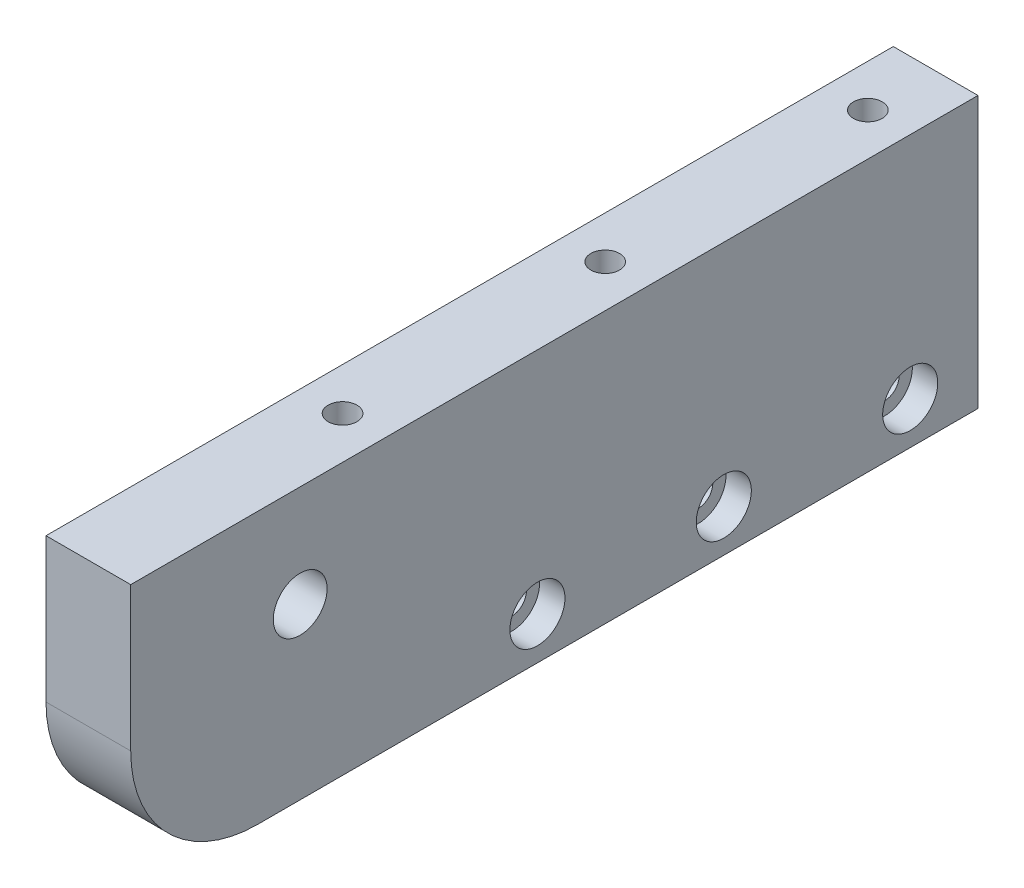
from build123d import *

# Parameters (mm, degrees)
SKETCH1_W                      = 100
SKETCH1_H                      = 32
SKETCH1_R                      = 3.175
BOSS_EXTRUDE1_DEPTH            = 10
FILLET1_R                      = 15
CBORE_FOR_M3_SHCS_D            = 3.4
CBORE_FOR_M3_SHCS_DEPTH        = 23
CBORE_FOR_M3_SHCS_CBORE_D      = 6.5
CBORE_FOR_M3_SHCS_CBORE_DEPTH  = 3
CBORE_FOR_M3_SHCS_TIP          = 1.021463052
CBORE_FOR_M3_SHCS1_D           = 3.4
CBORE_FOR_M3_SHCS1_DEPTH       = 23
CBORE_FOR_M3_SHCS1_CBORE_D     = 6.5
CBORE_FOR_M3_SHCS1_CBORE_DEPTH = 3
CBORE_FOR_M3_SHCS1_TIP         = 1.021463052


with BuildPart() as part:
    # Sketch1 → Boss-Extrude1 (new body)
    with BuildSketch(Plane(origin=(0, 0, 0), x_dir=(0, 0, -1), z_dir=(1, 0, 0))):
        Rectangle(SKETCH1_W, SKETCH1_H)
        with Locations((-30, 4)):
            Circle(SKETCH1_R, mode=Mode.SUBTRACT)
    extrude(amount=BOSS_EXTRUDE1_DEPTH)

    # Fillet1
    fillet1_edges = [part.edges().sort_by_distance(p)[0] for p in [
        (5, -16, 50),
    ]]
    fillet(fillet1_edges, radius=FILLET1_R)

    # CBORE for M3 SHCS
    with Locations(Plane(origin=(-726.293536786, 26, -1323.282701689), x_dir=(1, 0, 0), z_dir=(0, 1, 0))):
        with Locations((731.293536786, -1281.282701689), (731.293536786, -1343.282701689), (621.293536786, -1281.282701689), (621.293536786, -1365.282701689), (621.293536786, -1323.282701689), (731.293536786, -1312.282701689)):
            CounterBoreHole(CBORE_FOR_M3_SHCS_D / 2, CBORE_FOR_M3_SHCS_CBORE_D / 2, CBORE_FOR_M3_SHCS_CBORE_DEPTH, depth=CBORE_FOR_M3_SHCS_DEPTH)
            with Locations((0, 0, -(CBORE_FOR_M3_SHCS_DEPTH + CBORE_FOR_M3_SHCS_TIP / 2))):  # 118° drill point
                Cone(0, CBORE_FOR_M3_SHCS_D / 2, CBORE_FOR_M3_SHCS_TIP, mode=Mode.SUBTRACT)

    # CBORE for M3 SHCS1
    with Locations(Plane(origin=(10, -904.012147263, -1323.282701689), x_dir=(0, 0, -1), z_dir=(1, 0, 0))):
        with Locations((-1281.282701689, 893.012147263), (-1325.282701689, 893.012147263), (-1303.282701689, 893.012147263)):
            CounterBoreHole(CBORE_FOR_M3_SHCS1_D / 2, CBORE_FOR_M3_SHCS1_CBORE_D / 2, CBORE_FOR_M3_SHCS1_CBORE_DEPTH, depth=CBORE_FOR_M3_SHCS1_DEPTH)
            with Locations((0, 0, -(CBORE_FOR_M3_SHCS1_DEPTH + CBORE_FOR_M3_SHCS1_TIP / 2))):  # 118° drill point
                Cone(0, CBORE_FOR_M3_SHCS1_D / 2, CBORE_FOR_M3_SHCS1_TIP, mode=Mode.SUBTRACT)


solid = part.part
